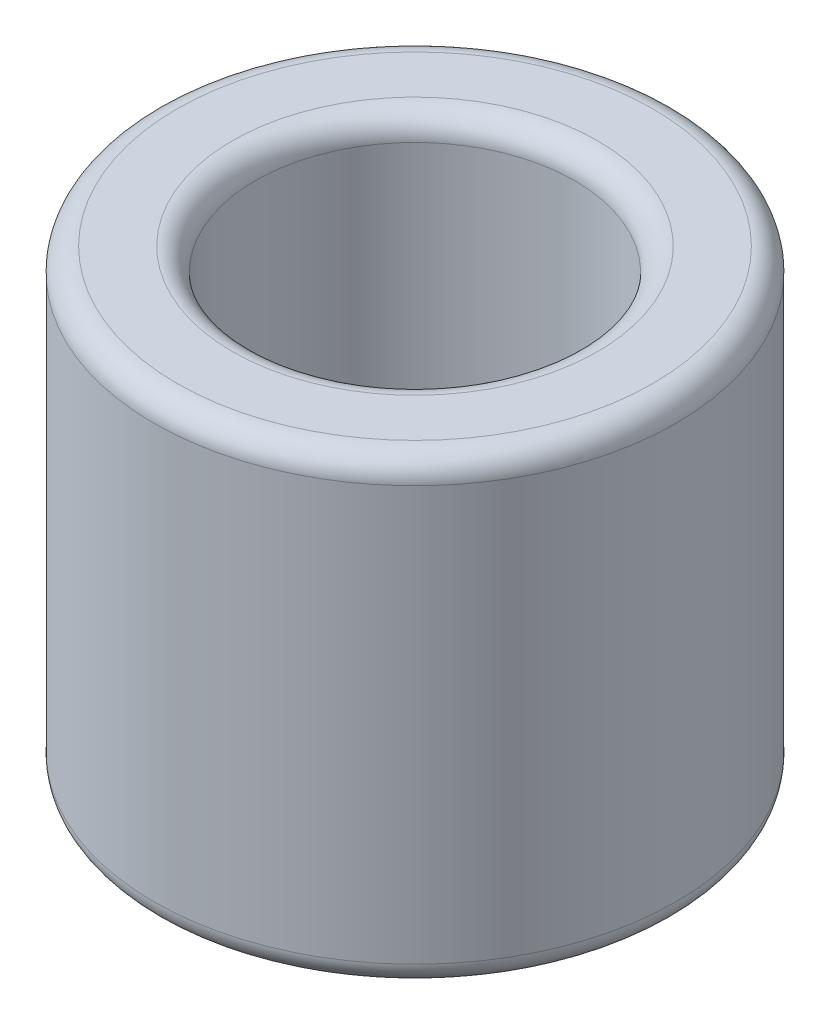
from build123d import *

# Parameters (mm, degrees)
SKETCH2_R    = 5.3975
SKETCH2_R_2  = 3.302
SPACER_DEPTH = 9.525
FILLET_2_R   = 0.47625


with BuildPart() as part:
    # Sketch2 → Spacer (new body)
    with BuildSketch(Plane(origin=(0, 0, 0), x_dir=(1, 0, 0), z_dir=(0, 1, 0))):
        Circle(SKETCH2_R)
        Circle(SKETCH2_R_2, mode=Mode.SUBTRACT)
    extrude(amount=SPACER_DEPTH)

    # Fillet 2
    fillet_2_edges = [part.edges().sort_by_distance(p)[0] for p in [
        (-3.302, 0, 0),
        (-5.3975, 0, 0),
        (-3.302, 9.525, 0),
        (-5.3975, 9.525, 0),
    ]]
    fillet(fillet_2_edges, radius=FILLET_2_R)


solid = part.part
